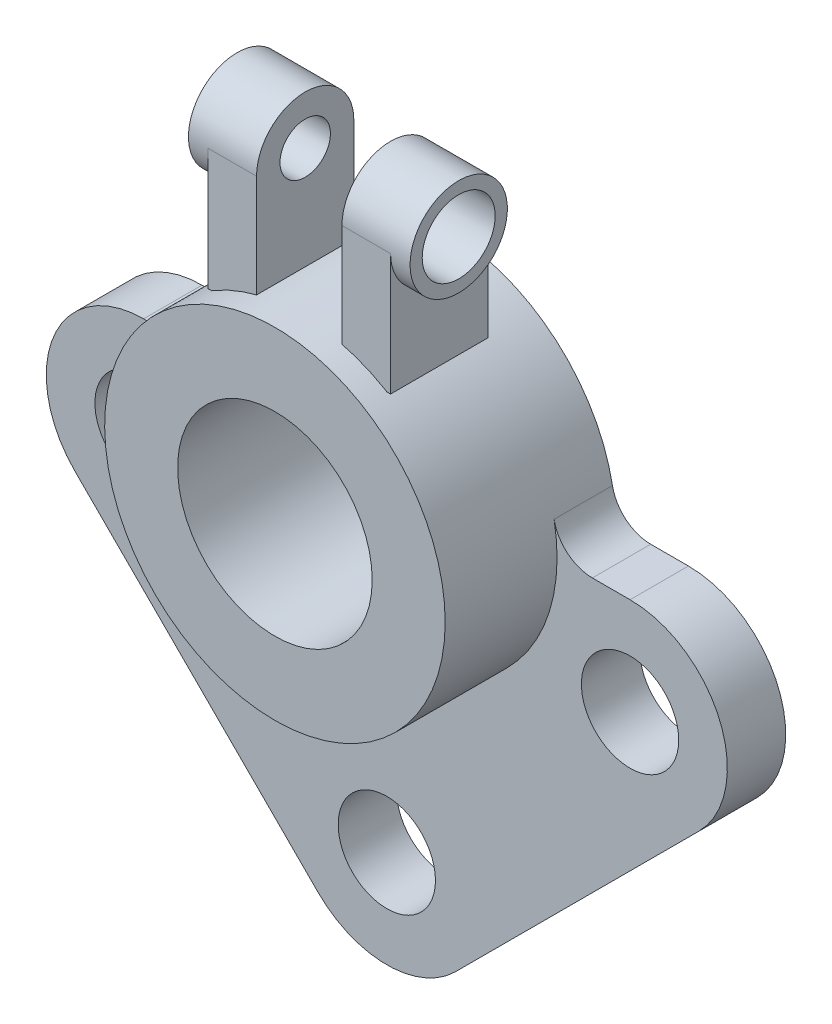
from build123d import *

# Parameters (mm, degrees)
ESQUISSE1_R             = 35
ESQUISSE1_R_2           = 20
BOSS_EXTRU_1_DEPTH      = 35
ESQUISSE2_R             = 10
BOSS_EXTRU_2_DEPTH      = 12
CONG_1_R                = 8
ESQUISSE4_W             = 10
ESQUISSE4_H             = 20
BOSS_EXTRU_3_DEPTH      = 25
BOSS_EXTRU_3_2_DEPTH    = 25
ESQUISSE6_R             = 10
BOSS_EXTRU_4_DEPTH      = 14
ESQUISSE8_R             = 5.182281133
ENL_V_MAT_EXTRU_1_DEPTH = 125.622425432
ESQUISSE14_R            = 10
BOSS_EXTRU_5_DEPTH      = 14
ESQUISSE15_R            = 7.5
ENL_V_MAT_EXTRU_2_DEPTH = 14


with BuildPart() as part:
    # Esquisse1 → Boss.-Extru.1 (new body)
    with BuildSketch(Plane.XY):
        Circle(ESQUISSE1_R)
        Circle(ESQUISSE1_R_2, mode=Mode.SUBTRACT)
    extrude(amount=BOSS_EXTRU_1_DEPTH)

    # Esquisse2 → Boss.-Extru.2 (add)
    with BuildSketch(Plane.XY):
        with BuildLine():
            Line((14.142135624, -84.142135624), (64.142135624, -34.142135624))
            ThreePointArc((64.142135624, -34.142135624), (68.47759065, -12.346331353), (50, 0))
            Line((50, 0), (35, 0))
            ThreePointArc((35, 0), (0, -35), (-35, 0))
            Line((-35, 0), (-50, 0))
            ThreePointArc((-50, 0), (-68.47759065, -12.346331353), (-64.142135624, -34.142135624))
            Line((-64.142135624, -34.142135624), (-14.142135624, -84.142135624))
            ThreePointArc((-14.142135624, -84.142135624), (0, -90), (14.142135624, -84.142135624))
        make_face()
        with Locations((50, -20)):
            Circle(ESQUISSE2_R, mode=Mode.SUBTRACT)
        with Locations((0, -70)):
            Circle(ESQUISSE2_R, mode=Mode.SUBTRACT)
        with Locations((-50, -20)):
            Circle(ESQUISSE2_R, mode=Mode.SUBTRACT)
    extrude(amount=BOSS_EXTRU_2_DEPTH)

    # Congé1
    # the kernel refuses this fillet: 8 mm, written as the material it adds along each edge
    with BuildSketch(Plane(origin=(35, 0, 0), x_dir=(-0.09343195829454301, 0.9956256671908608, 0), z_dir=(0, 0, 1))) as cong_1_piece_1:
        with BuildLine():
            CenterArc((7.287692747, -7.965005338), CONG_1_R, 95.361076208, 79.277847584)
            Line((-0.677312591, -7.217549671), (0, 0))
            ThreePointArc((0, 0), (3.27011854, -0.153101648), (6.540237081, 0))
        make_face()
    extrude(amount=12)
    with BuildSketch(Plane(origin=(-35, 0, 0), x_dir=(0.093431958294544, 0.9956256671908608, 0), z_dir=(0, 0, 1))) as cong_1_piece_2:
        with BuildLine():
            CenterArc((7.287692747, 7.965005338), CONG_1_R, 185.361076208, 79.277847584)
            Line((-0.677312591, 7.217549671), (0, 0))
            ThreePointArc((0, 0), (3.27011854, 0.153101648), (6.540237081, 0))
        make_face()
    extrude(amount=12)


with BuildPart() as body_2:
    # Esquisse4 → Boss.-Extru.3 (new body)
    with BuildSketch(Plane(origin=(0, 30, 0), x_dir=(1, 0, 0), z_dir=(0, 1, 0))):
        with Locations((13.776575964, -20)):
            Rectangle(ESQUISSE4_W, ESQUISSE4_H)
    extrude(amount=BOSS_EXTRU_3_DEPTH)

    # Esquisse14 → Boss.-Extru.5 (add)
    with BuildSketch(Plane.ZY.offset(-8.776575964)):
        with Locations(Location((20, 55, 0), (0, 0, 180))):
            Circle(ESQUISSE14_R)
    extrude(amount=-BOSS_EXTRU_5_DEPTH)

    # Esquisse15 → Enlèv. mat.-Extru.2 (cut)
    with BuildSketch(Plane.ZY.offset(-8.776575964)):
        with Locations((20, 55)):
            Circle(ESQUISSE15_R)
    extrude(amount=-ENL_V_MAT_EXTRU_2_DEPTH, mode=Mode.SUBTRACT)


with BuildPart() as body_3:
    # Esquisse4 → Boss.-Extru.3 2 (new body)
    with BuildSketch(Plane(origin=(0, 30, 0), x_dir=(1, 0, 0), z_dir=(0, 1, 0))):
        with Locations((-13.776575964, -20)):
            Rectangle(ESQUISSE4_W, ESQUISSE4_H)
    extrude(amount=BOSS_EXTRU_3_2_DEPTH)

    # Esquisse6 → Boss.-Extru.4 (add)
    with BuildSketch(Plane(origin=(-8.776575964, 0, 0), x_dir=(0, 0, -1), z_dir=(1, 0, 0))):
        with Locations((-20, 55)):
            Circle(ESQUISSE6_R)
    extrude(amount=-BOSS_EXTRU_4_DEPTH)

    # Esquisse8 → Enlèv. mat.-Extru.1 (cut, through all)
    with BuildSketch(Plane(origin=(-8.776575964, 0, 0), x_dir=(0, 0, -1), z_dir=(1, 0, 0))):
        with Locations((-20, 55)):
            Circle(ESQUISSE8_R)
    extrude(amount=-ENL_V_MAT_EXTRU_1_DEPTH, mode=Mode.SUBTRACT)


solid = Compound([part.part, body_2.part, body_3.part])
